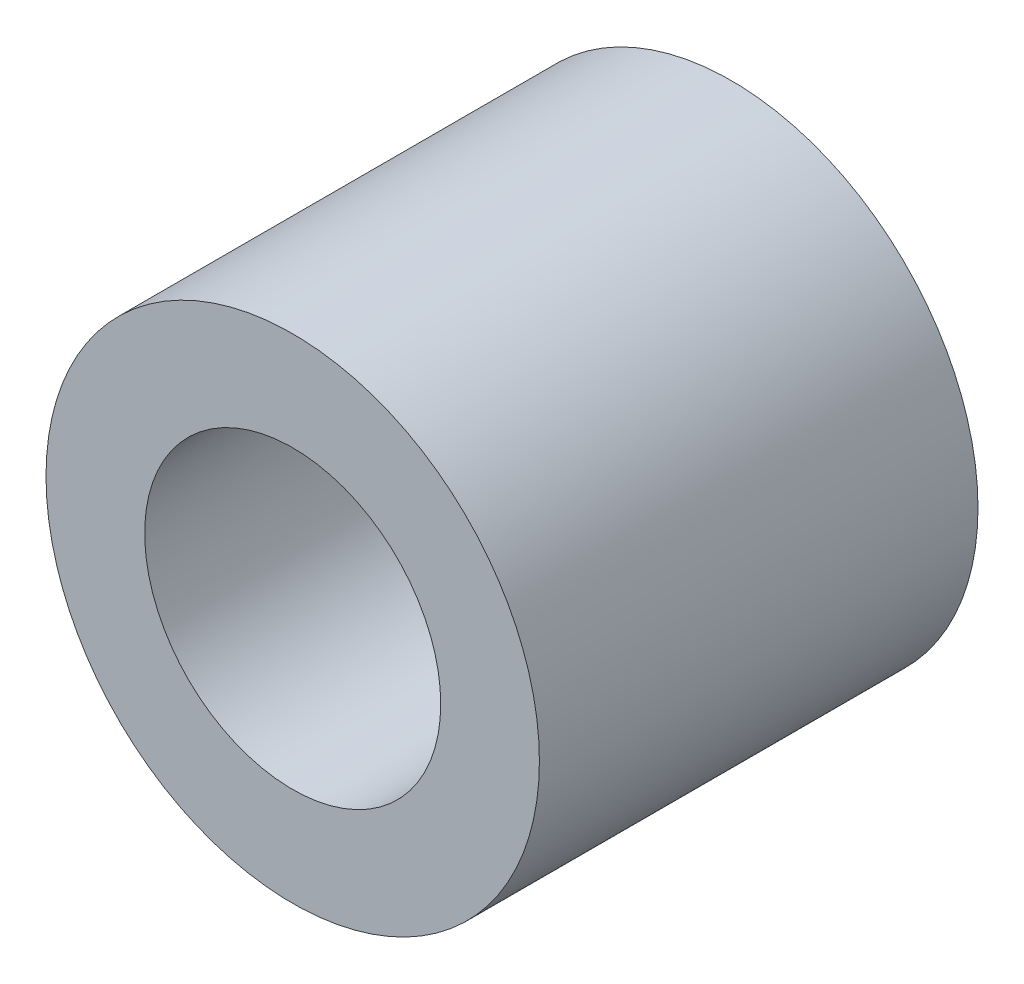
from build123d import *

# Parameters (mm, degrees)
SKETCH1_R      = 2.25
SKETCH1_R_2    = 1.35
EXTRUDE1_DEPTH = 2


with BuildPart() as part:
    # Sketch1 → Extrude1 (new, symmetric)
    with BuildSketch(Plane.XY):
        Circle(SKETCH1_R)
        Circle(SKETCH1_R_2, mode=Mode.SUBTRACT)
    extrude(amount=EXTRUDE1_DEPTH, both=True)


solid = part.part
